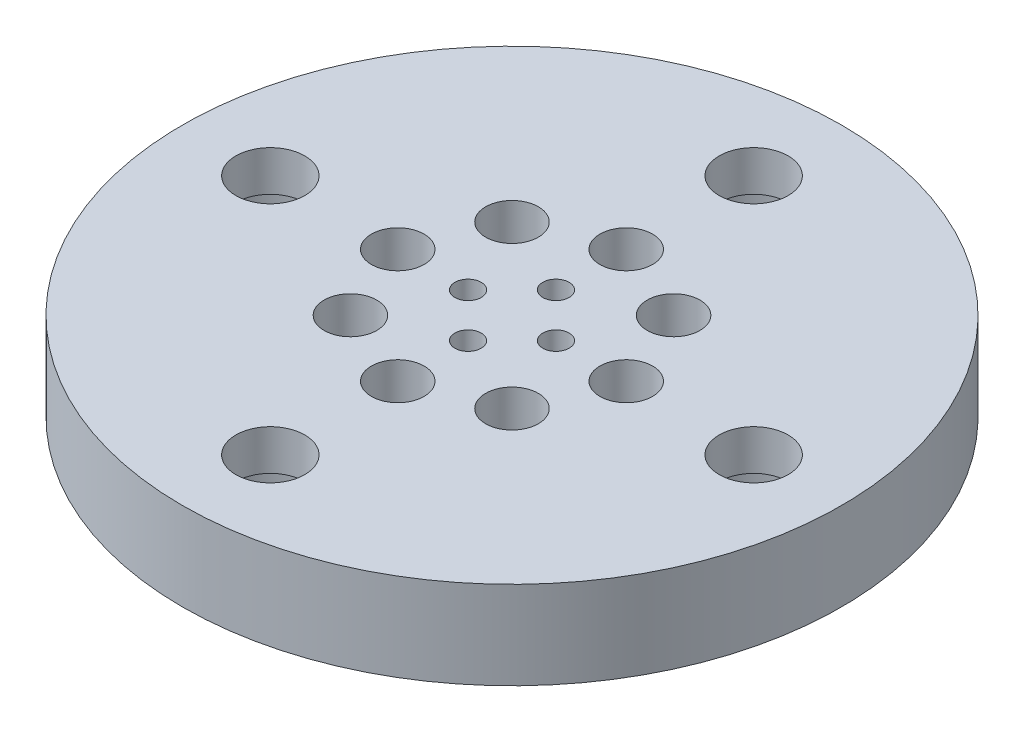
from build123d import *

# Parameters (mm, degrees)
SKETCH1_R                                           = 50.8
BOSS_EXTRUDE1_DEPTH                                 = 25.4
SKETCH2_R                                           = 69.85
SKETCH2_R_2                                         = 50.8
BOSS_EXTRUDE2_DEPTH                                 = 12.7
SKETCH3_R                                           = 49.53
SKETCH3_R_2                                         = 47.625
CUT_EXTRUDE1_DEPTH                                  = 1.1176
CUT_EXTRUDE2_REACH                                  = 103.996
SKETCH4_R                                           = 3.175
SKETCH5_R                                           = 11.43
CUT_EXTRUDE3_DEPTH                                  = 19.05
SKETCH42_OUTSIDE_W                                  = 181.538
SKETCH42_OUTSIDE_H                                  = 181.538
SKETCH42_OUTSIDE_R                                  = 23.8125
CUT_EXTRUDE9_DEPTH                                  = 30.48
SKETCH43_R                                          = 20.6375
CUT_EXTRUDE10_DEPTH                                 = 19.05
CBORE_FOR_10_BINDING_HEAD_MACHINE_SCREW_D           = 4.9784
CBORE_FOR_10_BINDING_HEAD_MACHINE_SCREW_CBORE_D     = 9.525
CBORE_FOR_10_BINDING_HEAD_MACHINE_SCREW_CBORE_DEPTH = 3.429
CUT_EXTRUDE11_START                                 = -19.05
SKETCH52_R                                          = 23.8125
CUT_EXTRUDE11_DEPTH                                 = 19.05
SKETCH55_R                                          = 1.905
CUT_EXTRUDE12_DEPTH                                 = 7.62
CIRPATTERN1_COUNT                                   = 8
SKETCH58_R                                          = 0.9525
CUT_EXTRUDE14_DEPTH                                 = 7.62
CIRPATTERN2_COUNT                                   = 4


with BuildPart() as part:
    # Sketch1 → Boss-Extrude1 (new body)
    with BuildSketch(Plane(origin=(0, 0, 0), x_dir=(1, 0, 0), z_dir=(0, 1, 0))):
        Circle(SKETCH1_R)
    extrude(amount=BOSS_EXTRUDE1_DEPTH)

    # Sketch2 → Boss-Extrude2 (add)
    with BuildSketch(Plane.XZ):
        Circle(SKETCH2_R)
        Circle(SKETCH2_R_2, mode=Mode.SUBTRACT)
    extrude(amount=-BOSS_EXTRUDE2_DEPTH)

    # Sketch3 → Cut-Extrude1 (cut)
    with BuildSketch(Plane.XZ):
        Circle(SKETCH3_R)
        Circle(SKETCH3_R_2, mode=Mode.SUBTRACT)
    extrude(amount=-CUT_EXTRUDE1_DEPTH, mode=Mode.SUBTRACT)

    # Sketch4 → Cut-Extrude2 (cut, up to next)
    with BuildSketch(Plane.XZ, mode=Mode.PRIVATE) as cut_extrude2_sk1:
        with Locations((0, -59.9186)):
            Circle(SKETCH4_R)
    cut_extrude2_tool1 = extrude(cut_extrude2_sk1.sketch, amount=-CUT_EXTRUDE2_REACH, mode=Mode.PRIVATE) & part.part
    # Sketch4 → Cut-Extrude2 (cut, up to next)
    with BuildSketch(Plane.XZ, mode=Mode.PRIVATE) as cut_extrude2_sk2:
        with Locations((-42.368848379, -42.368848379)):
            Circle(SKETCH4_R)
    cut_extrude2_tool2 = extrude(cut_extrude2_sk2.sketch, amount=-CUT_EXTRUDE2_REACH, mode=Mode.PRIVATE) & part.part
    # Sketch4 → Cut-Extrude2 (cut, up to next)
    with BuildSketch(Plane.XZ, mode=Mode.PRIVATE) as cut_extrude2_sk3:
        with Locations((-59.9186, 0)):
            Circle(SKETCH4_R)
    cut_extrude2_tool3 = extrude(cut_extrude2_sk3.sketch, amount=-CUT_EXTRUDE2_REACH, mode=Mode.PRIVATE) & part.part
    # Sketch4 → Cut-Extrude2 (cut, up to next)
    with BuildSketch(Plane.XZ, mode=Mode.PRIVATE) as cut_extrude2_sk4:
        with Locations((-42.368848379, 42.368848379)):
            Circle(SKETCH4_R)
    cut_extrude2_tool4 = extrude(cut_extrude2_sk4.sketch, amount=-CUT_EXTRUDE2_REACH, mode=Mode.PRIVATE) & part.part
    # Sketch4 → Cut-Extrude2 (cut, up to next)
    with BuildSketch(Plane.XZ, mode=Mode.PRIVATE) as cut_extrude2_sk5:
        with Locations((0, 59.9186)):
            Circle(SKETCH4_R)
    cut_extrude2_tool5 = extrude(cut_extrude2_sk5.sketch, amount=-CUT_EXTRUDE2_REACH, mode=Mode.PRIVATE) & part.part
    # Sketch4 → Cut-Extrude2 (cut, up to next)
    with BuildSketch(Plane.XZ, mode=Mode.PRIVATE) as cut_extrude2_sk6:
        with Locations((42.368848379, 42.368848379)):
            Circle(SKETCH4_R)
    cut_extrude2_tool6 = extrude(cut_extrude2_sk6.sketch, amount=-CUT_EXTRUDE2_REACH, mode=Mode.PRIVATE) & part.part
    # Sketch4 → Cut-Extrude2 (cut, up to next)
    with BuildSketch(Plane.XZ, mode=Mode.PRIVATE) as cut_extrude2_sk7:
        with Locations((59.9186, 0)):
            Circle(SKETCH4_R)
    cut_extrude2_tool7 = extrude(cut_extrude2_sk7.sketch, amount=-CUT_EXTRUDE2_REACH, mode=Mode.PRIVATE) & part.part
    # Sketch4 → Cut-Extrude2 (cut, up to next)
    with BuildSketch(Plane.XZ, mode=Mode.PRIVATE) as cut_extrude2_sk8:
        with Locations((42.368848379, -42.368848379)):
            Circle(SKETCH4_R)
    cut_extrude2_tool8 = extrude(cut_extrude2_sk8.sketch, amount=-CUT_EXTRUDE2_REACH, mode=Mode.PRIVATE) & part.part
    add(cut_extrude2_tool1.solids().sort_by_distance((0, 0, -59.9186))[0], mode=Mode.SUBTRACT)
    add(cut_extrude2_tool2.solids().sort_by_distance((-42.368848, 0, -42.368848))[0], mode=Mode.SUBTRACT)
    add(cut_extrude2_tool3.solids().sort_by_distance((-59.9186, 0, 0))[0], mode=Mode.SUBTRACT)
    add(cut_extrude2_tool4.solids().sort_by_distance((-42.368848, 0, 42.368848))[0], mode=Mode.SUBTRACT)
    add(cut_extrude2_tool5.solids().sort_by_distance((0, 0, 59.9186))[0], mode=Mode.SUBTRACT)
    add(cut_extrude2_tool6.solids().sort_by_distance((42.368848, 0, 42.368848))[0], mode=Mode.SUBTRACT)
    add(cut_extrude2_tool7.solids().sort_by_distance((59.9186, 0, 0))[0], mode=Mode.SUBTRACT)
    add(cut_extrude2_tool8.solids().sort_by_distance((42.368848, 0, -42.368848))[0], mode=Mode.SUBTRACT)

    # Sketch5 → Cut-Extrude3 (cut)
    with BuildSketch(Plane(origin=(0, 25.4, 0), x_dir=(1, 0, 0), z_dir=(0, 1, 0))):
        Circle(SKETCH5_R)
    extrude(amount=-CUT_EXTRUDE3_DEPTH, mode=Mode.SUBTRACT)

    # Sketch42 outside → Cut-Extrude9 (cut)
    with BuildSketch(Plane.XZ):
        Rectangle(SKETCH42_OUTSIDE_W, SKETCH42_OUTSIDE_H)
        Circle(SKETCH42_OUTSIDE_R, mode=Mode.SUBTRACT)
    extrude(amount=-CUT_EXTRUDE9_DEPTH, mode=Mode.SUBTRACT)

    # Sketch43 → Cut-Extrude10 (cut)
    with BuildSketch(Plane(origin=(0, 25.4, 0), x_dir=(1, 0, 0), z_dir=(0, 1, 0))):
        Circle(SKETCH43_R)
    extrude(amount=-CUT_EXTRUDE10_DEPTH, mode=Mode.SUBTRACT)

    # CBORE for #10 Binding Head Machine Screw1 (through all)
    with Locations(Plane(origin=(0, 0, 0), x_dir=(-1, 0, 0), z_dir=(0, -1, 0))):
        with Locations((0, -17.4625), (-17.4625, 0), (17.4625, 0), (0, 17.4625)):
            CounterBoreHole(CBORE_FOR_10_BINDING_HEAD_MACHINE_SCREW_D / 2, CBORE_FOR_10_BINDING_HEAD_MACHINE_SCREW_CBORE_D / 2, CBORE_FOR_10_BINDING_HEAD_MACHINE_SCREW_CBORE_DEPTH)

    # Sketch52 → Cut-Extrude11 (cut)
    with BuildSketch(Plane(origin=(0, 25.4, 0), x_dir=(1, 0, 0), z_dir=(0, 1, 0)).offset(CUT_EXTRUDE11_START)):
        Circle(SKETCH52_R)
    extrude(amount=CUT_EXTRUDE11_DEPTH, mode=Mode.SUBTRACT)

    # Sketch55 → Cut-Extrude12 (cut)
    with BuildSketch(Plane.XZ):
        with Locations((8.255, 0)):
            Circle(SKETCH55_R)
    cut_extrude12 = extrude(amount=-CUT_EXTRUDE12_DEPTH, mode=Mode.SUBTRACT)

    # CirPattern1: Cut-Extrude12 ×8 about axis
    cirpattern1_axis = Axis((0, 0, 0), (0, -1, 0))
    for i in range(1, CIRPATTERN1_COUNT):
        add(cut_extrude12.rotate(cirpattern1_axis, i * 360 / CIRPATTERN1_COUNT), mode=Mode.SUBTRACT)

    # Sketch58 → Cut-Extrude14 (cut)
    with BuildSketch(Plane.XZ):
        with Locations((3.175, 0)):
            Circle(SKETCH58_R)
    cut_extrude14 = extrude(amount=-CUT_EXTRUDE14_DEPTH, mode=Mode.SUBTRACT)

    # CirPattern2: Cut-Extrude14 ×4 about axis
    cirpattern2_axis = Axis((0, 0, 0), (0, -1, 0))
    for i in range(1, CIRPATTERN2_COUNT):
        add(cut_extrude14.rotate(cirpattern2_axis, i * 360 / CIRPATTERN2_COUNT), mode=Mode.SUBTRACT)


solid = part.part
